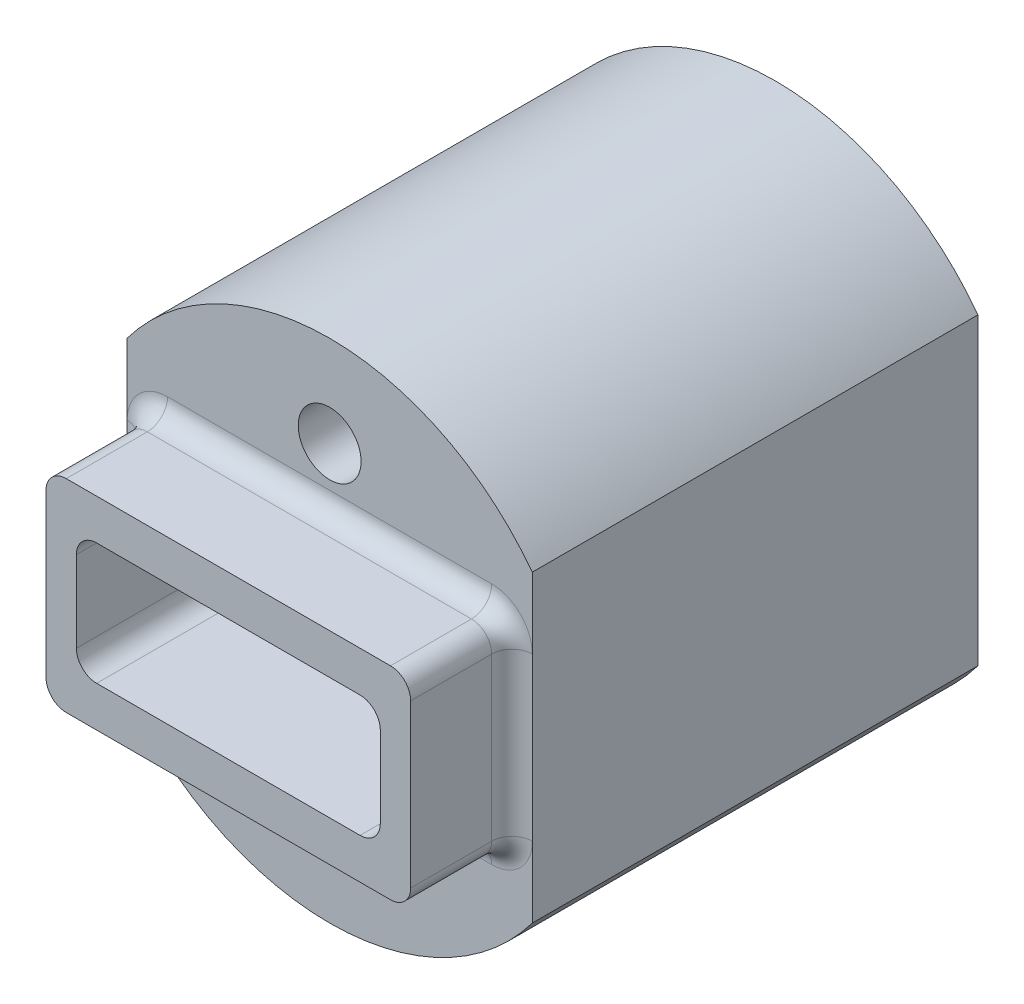
from build123d import *

# Parameters (mm, degrees)
AUFSATZ_LINEAR_AUSTRAGEN1_DEPTH      = 7.5
AUFSATZ_LINEAR_AUSTRAGEN1_DEPTH_BACK = 14.5
SKIZZE1_R                            = 12.5
SKIZZE1_R_2                          = 1.55
SCHNITT_LINEAR_AUSTRAGEN1_DEPTH      = 4.5
AUFSATZ_LINEAR_AUSTRAGEN2_DEPTH      = 5
SCHNITT_LINEAR_AUSTRAGEN4_DEPTH      = 23.86372673
SCHNITT_LINEAR_AUSTRAGEN4_DEPTH_BACK = 23.86372673
SCHNITT_LINEAR_AUSTRAGEN5_DEPTH      = 10
SCHNITT_LINEAR_AUSTRAGEN5_DEPTH_BACK = 23.86372673
SKIZZE5_OUTSIDE_W                    = 35.898
SKIZZE5_OUTSIDE_H                    = 35.898
SKIZZE5_OUTSIDE_W_2                  = 20
SKIZZE5_OUTSIDE_H_2                  = 30
VERRUNDUNG1_R                        = 1.2
VERRUNDUNG2_R                        = 1


with BuildPart() as part:
    # Skizze1 → Aufsatz-Linear austragen1 (new, two sides: drawn at the far end of the back side and taken through both)
    with BuildSketch(Plane.XY.offset(-AUFSATZ_LINEAR_AUSTRAGEN1_DEPTH_BACK)):
        Circle(SKIZZE1_R)
        with Locations((0, 8)):
            Circle(SKIZZE1_R_2, mode=Mode.SUBTRACT)
        with Locations((0, -8)):
            Circle(SKIZZE1_R_2, mode=Mode.SUBTRACT)
    extrude(amount=AUFSATZ_LINEAR_AUSTRAGEN1_DEPTH + AUFSATZ_LINEAR_AUSTRAGEN1_DEPTH_BACK)

    # Skizze2 → Schnitt-Linear austragen1 (cut)
    with BuildSketch(Plane(origin=(0, 0, -14.5), x_dir=(-1, 0, 0), z_dir=(0, 0, -1))):
        with BuildLine():
            Line((-9, -4), (-9, 4))
            ThreePointArc((-9, 4), (-8.707106781, 4.707106781), (-8, 5))
            Line((-8, 5), (8, 5))
            ThreePointArc((8, 5), (8.707106781, 4.707106781), (9, 4))
            Line((9, 4), (9, -4))
            ThreePointArc((9, -4), (8.707106781, -4.707106781), (8, -5))
            Line((8, -5), (-8, -5))
            ThreePointArc((-8, -5), (-8.707106781, -4.707106781), (-9, -4))
        make_face()
    extrude(amount=-SCHNITT_LINEAR_AUSTRAGEN1_DEPTH, mode=Mode.SUBTRACT)

    # Skizze3 → Aufsatz-Linear austragen2 (add)
    with BuildSketch(Plane.XY.offset(7.5)):
        with BuildLine():
            Line((-8, 5), (8, 5))
            ThreePointArc((8, 5), (8.707106781, 4.707106781), (9, 4))
            Line((9, 4), (9, -4))
            ThreePointArc((9, -4), (8.707106781, -4.707106781), (8, -5))
            Line((8, -5), (-8, -5))
            ThreePointArc((-8, -5), (-8.707106781, -4.707106781), (-9, -4))
            Line((-9, -4), (-9, 4))
            ThreePointArc((-9, 4), (-8.707106781, 4.707106781), (-8, 5))
        make_face()
    extrude(amount=AUFSATZ_LINEAR_AUSTRAGEN2_DEPTH)

    # Skizze4 → Schnitt-Linear austragen4 (cut, two sides: drawn at the far end of the back side and taken through both)
    with BuildSketch(Plane.XY.offset(-SCHNITT_LINEAR_AUSTRAGEN4_DEPTH_BACK)):
        with BuildLine():
            Line((-6.5, -3), (6.5, -3))
            ThreePointArc((6.5, -3), (7.207106781, -2.707106781), (7.5, -2))
            Line((7.5, -2), (7.5, 2))
            ThreePointArc((7.5, 2), (7.207106781, 2.707106781), (6.5, 3))
            Line((6.5, 3), (-6.5, 3))
            ThreePointArc((-6.5, 3), (-7.207106781, 2.707106781), (-7.5, 2))
            Line((-7.5, 2), (-7.5, -2))
            ThreePointArc((-7.5, -2), (-7.207106781, -2.707106781), (-6.5, -3))
        make_face()
    extrude(amount=SCHNITT_LINEAR_AUSTRAGEN4_DEPTH + SCHNITT_LINEAR_AUSTRAGEN4_DEPTH_BACK, mode=Mode.SUBTRACT)

    # Skizze5 outside → Schnitt-Linear austragen5 (cut, two sides: drawn at the far end of the back side and taken through both)
    with BuildSketch(Plane.XY.offset(-SCHNITT_LINEAR_AUSTRAGEN5_DEPTH_BACK)):
        Rectangle(SKIZZE5_OUTSIDE_W, SKIZZE5_OUTSIDE_H)
        Rectangle(SKIZZE5_OUTSIDE_W_2, SKIZZE5_OUTSIDE_H_2, mode=Mode.SUBTRACT)
    extrude(amount=SCHNITT_LINEAR_AUSTRAGEN5_DEPTH + SCHNITT_LINEAR_AUSTRAGEN5_DEPTH_BACK, mode=Mode.SUBTRACT)

    # Verrundung1
    verrundung1_edges = [part.edges().sort_by_distance(p)[0] for p in [
        (-8.707106781, 4.707106781, -14.5),
        (-8.707106781, -4.707106781, -14.5),
        (0, -5, -14.5),
        (8.707106781, -4.707106781, -14.5),
        (8.707106781, 4.707106781, -14.5),
        (0, 5, -14.5),
    ]]
    fillet(verrundung1_edges, radius=VERRUNDUNG1_R)

    # Verrundung2
    verrundung2_edges = [part.edges().sort_by_distance(p)[0] for p in [
        (8.707106781, 4.707106781, 7.5),
        (0, 5, 7.5),
        (-8.707106781, 4.707106781, 7.5),
        (-9, 0, 7.5),
        (-8.707106781, -4.707106781, 7.5),
        (0, -5, 7.5),
        (8.707106781, -4.707106781, 7.5),
        (9, 0, 7.5),
    ]]
    fillet(verrundung2_edges, radius=VERRUNDUNG2_R - 0.0001)  # a hair under: the kernel refuses the full size


solid = part.part
